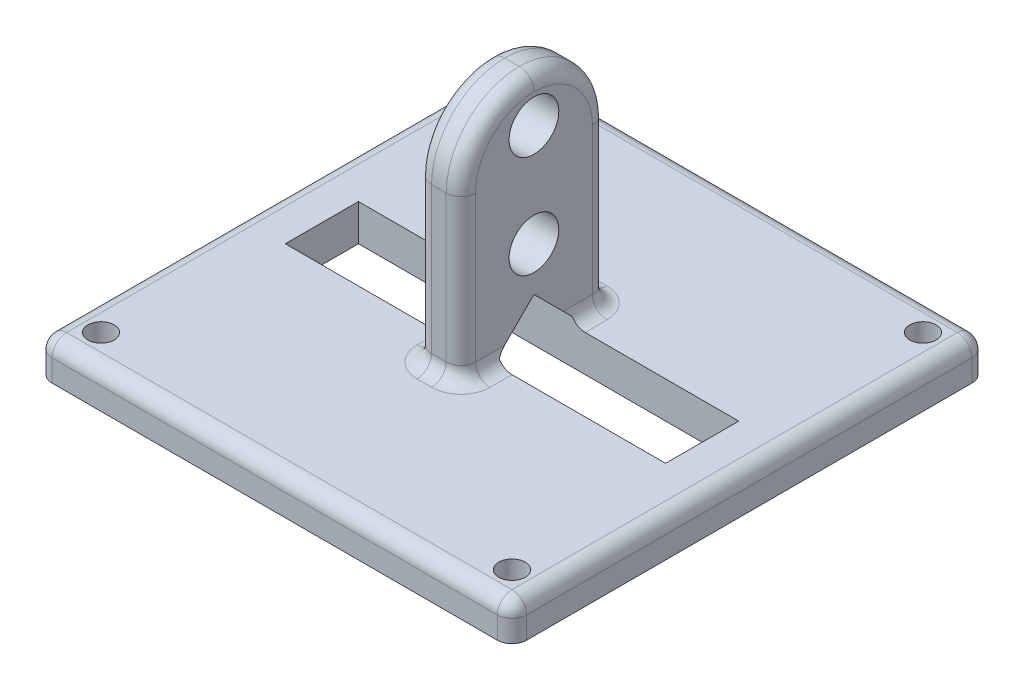
from build123d import *

# Parameters (mm, degrees)
SKETCH1_W            = 32.45
SKETCH1_H            = 32.45
SKETCH1_R            = 0.9
SKETCH1_W_2          = 26
SKETCH1_H_2          = 5
BOSS_EXTRUDE1_DEPTH  = 2.5
SKETCH3_W            = 3
SKETCH3_H            = 2.5
BOSS_EXTRUDE2_DEPTH  = 3
SKETCH4_W            = 3
SKETCH4_H            = 10
BOSS_EXTRUDE3_DEPTH  = 13
CHAMFER1_SIZE        = 2.5
M3_CLEARANCE_HOLE2_D = 3.4
FILLET1_R            = 5
FILLET2_R            = 1


# Some blends are built 0.0001 mm under size
with BuildPart() as part:
    # Sketch1 → Boss-Extrude1 (new body)
    with BuildSketch(Plane(origin=(0, 0, 0), x_dir=(1, 0, 0), z_dir=(0, 1, 0))):
        Rectangle(SKETCH1_W, SKETCH1_H)
        with Locations(Location((-14.05, 14.05, 0), (0, 0, 270))):
            Circle(SKETCH1_R, mode=Mode.SUBTRACT)
        with Locations(Location((14.05, 14.05, 0), (0, 0, 270))):
            Circle(SKETCH1_R, mode=Mode.SUBTRACT)
        with Locations(Location((14.05, -14.05, 0), (0, 0, 270))):
            Circle(SKETCH1_R, mode=Mode.SUBTRACT)
        with Locations(Location((-14.05, -14.05, 0), (0, 0, 270))):
            Circle(SKETCH1_R, mode=Mode.SUBTRACT)
        Rectangle(SKETCH1_W_2, SKETCH1_H_2, mode=Mode.SUBTRACT)
    extrude(amount=BOSS_EXTRUDE1_DEPTH)

    # Sketch3 → Boss-Extrude2 (add)
    with BuildSketch(Plane(origin=(0, 2.5, 0), x_dir=(1, 0, 0), z_dir=(0, 1, 0))):
        with Locations((0, -3.75)):
            Rectangle(SKETCH3_W, SKETCH3_H)
        with Locations((0, 3.75)):
            Rectangle(SKETCH3_W, SKETCH3_H)
    extrude(amount=BOSS_EXTRUDE2_DEPTH)

    # Sketch4 → Boss-Extrude3 (add)
    with BuildSketch(Plane(origin=(0, 5.5, 0), x_dir=(1, 0, 0), z_dir=(0, 1, 0))):
        Rectangle(SKETCH4_W, SKETCH4_H)
    extrude(amount=BOSS_EXTRUDE3_DEPTH)

    # Chamfer1
    chamfer1_edges = [part.edges().sort_by_distance(p)[0] for p in [
        (0, 5.5, 2.5),
        (0, 5.5, -2.5),
    ]]
    chamfer(chamfer1_edges, length=CHAMFER1_SIZE - 0.0001)  # a hair under: the kernel refuses the full size

    # M3 Clearance Hole2 (through all)
    with Locations(Plane(origin=(1.5, 0, 0), x_dir=(0, 0, -1), z_dir=(1, 0, 0))):
        with Locations((0, 15.5), (0, 8.5)):
            Hole(M3_CLEARANCE_HOLE2_D / 2)

    # Fillet1
    fillet1_edges = [part.edges().sort_by_distance(p)[0] for p in [
        (0, 18.5, -5),
        (0, 18.5, 5),
    ]]
    fillet(fillet1_edges, radius=FILLET1_R - 0.0001)  # a hair under: the kernel refuses the full size

    # Fillet2
    # the kernel refuses this fillet: 1 mm, written as the material it takes off along each edge
    with BuildSketch(Plane(origin=(-15.225, 1.5, -15.225), x_dir=(0, 0, -1), z_dir=(-1, 0, 0))) as fillet2_piece_1_section:
        Polygon((0, 0), (FILLET2_R, 0), (FILLET2_R, -FILLET2_R), (0, -FILLET2_R), align=None)
    fillet2_piece_1 = extrude(amount=FILLET2_R, mode=Mode.PRIVATE)
    fillet2_piece_1 = fillet2_piece_1 - Plane(origin=(-15.225, 1.5, -15.225), x_dir=(0, -0.7071067811865475, 0.7071067811865475), z_dir=(-1, 0, 0)) * Sphere(FILLET2_R, mode=Mode.PRIVATE)
    add(fillet2_piece_1, mode=Mode.SUBTRACT)
    with BuildSketch(Plane(origin=(15.225, 1.5, -15.225), x_dir=(0, 0, -1), z_dir=(1, 0, 0))) as fillet2_piece_2_section:
        Polygon((0, 0), (FILLET2_R, 0), (FILLET2_R, FILLET2_R), (0, FILLET2_R), align=None)
    fillet2_piece_2 = extrude(amount=FILLET2_R, mode=Mode.PRIVATE)
    fillet2_piece_2 = fillet2_piece_2 - Plane(origin=(15.225, 1.5, -15.225), x_dir=(0, -0.7071067811865475, 0.7071067811865475), z_dir=(1, 0, 0)) * Sphere(FILLET2_R, mode=Mode.PRIVATE)
    add(fillet2_piece_2, mode=Mode.SUBTRACT)
    with BuildSketch(Plane(origin=(-15.225, 1.5, 15.225), x_dir=(0, 1, 0), z_dir=(-1, 0, 0))) as fillet2_piece_3_section:
        Polygon((0, 0), (FILLET2_R, 0), (FILLET2_R, -FILLET2_R), (0, -FILLET2_R), align=None)
    fillet2_piece_3 = extrude(amount=FILLET2_R, mode=Mode.PRIVATE)
    fillet2_piece_3 = fillet2_piece_3 - Plane(origin=(-15.225, 1.5, 15.225), x_dir=(0, -0.7071067811865475, -0.7071067811865475), z_dir=(-1, 0, 0)) * Sphere(FILLET2_R, mode=Mode.PRIVATE)
    add(fillet2_piece_3, mode=Mode.SUBTRACT)
    with BuildSketch(Plane(origin=(15.225, 1.5, 15.225), x_dir=(0, 1, 0), z_dir=(1, 0, 0))) as fillet2_piece_4_section:
        Polygon((0, 0), (FILLET2_R, 0), (FILLET2_R, FILLET2_R), (0, FILLET2_R), align=None)
    fillet2_piece_4 = extrude(amount=FILLET2_R, mode=Mode.PRIVATE)
    fillet2_piece_4 = fillet2_piece_4 - Plane(origin=(15.225, 1.5, 15.225), x_dir=(0, -0.7071067811865475, -0.7071067811865475), z_dir=(1, 0, 0)) * Sphere(FILLET2_R, mode=Mode.PRIVATE)
    add(fillet2_piece_4, mode=Mode.SUBTRACT)
    with BuildSketch(Plane(origin=(-1.5, 13.5001, -5), x_dir=(0, 0, 1), z_dir=(0, -1, 0))) as fillet2_piece_5:
        with BuildLine():
            CenterArc((FILLET2_R, -FILLET2_R), FILLET2_R, 90, 90)
            Line((0, -FILLET2_R), (0, 0))
            Line((0, 0), (FILLET2_R, 0))
        make_face()
    extrude(amount=11.0001, mode=Mode.SUBTRACT)
    with BuildSketch(Plane(origin=(-1.5, 13.5001, -0.0001), x_dir=(0, 1, 0), z_dir=(0, 0, 1))) as fillet2_piece_6:
        with BuildLine():
            CenterArc((4.9999 - FILLET2_R, -FILLET2_R), FILLET2_R, 0, 90)
            Line((4.9999, -FILLET2_R), (4.9999, 0))
            Line((4.9999, 0), (4.9999 - FILLET2_R, 0))
        make_face()
    revolve(axis=Axis((-1.5, 13.5001, -0.0001), (-1, 0, 0)), revolution_arc=90, mode=Mode.SUBTRACT)
    with BuildSketch(Plane(origin=(-1.5, 13.5001, 0.0001), x_dir=(0, 0, 1), z_dir=(0, -1, 0))) as fillet2_piece_7:
        with BuildLine():
            CenterArc((4.9999 - FILLET2_R, -FILLET2_R), FILLET2_R, 0, 90)
            Line((4.9999, -FILLET2_R), (4.9999, 0))
            Line((4.9999, 0), (4.9999 - FILLET2_R, 0))
        make_face()
    revolve(axis=Axis((-1.5, 13.5001, 0.0001), (-1, 0, 0)), revolution_arc=90, mode=Mode.SUBTRACT)
    with BuildSketch(Plane(origin=(1.5, 2.5, -5), x_dir=(-1, 0, 0), z_dir=(0, 1, 0)), Plane(origin=(-1.5, 13.5001, 5), x_dir=(0, 0, -1), z_dir=(0, -1, 0)), Plane(origin=(1.5, 13.5001, 5), x_dir=(-1, 0, 0), z_dir=(0, -1, 0))) as fillet2_piece_8:
        with BuildLine():
            CenterArc((FILLET2_R, FILLET2_R), FILLET2_R, 180, 90)
            Line((0, FILLET2_R), (0, 0))
            Line((0, 0), (FILLET2_R, 0))
        make_face()
    extrude(amount=11.0001, mode=Mode.SUBTRACT)
    with BuildSketch(Plane(origin=(1.5, 13.5001, -0.0001), x_dir=(0, 1, 0), z_dir=(0, 0, 1))) as fillet2_piece_9:
        with BuildLine():
            CenterArc((4.9999 - FILLET2_R, FILLET2_R), FILLET2_R, 270, 90)
            Line((4.9999 - FILLET2_R, 0), (4.9999, 0))
            Line((4.9999, 0), (4.9999, FILLET2_R))
        make_face()
    revolve(axis=Axis((1.5, 13.5001, -0.0001), (-1, 0, 0)), revolution_arc=90, mode=Mode.SUBTRACT)
    with BuildSketch(Plane(origin=(1.5, 13.5001, 0.0001), x_dir=(0, 0, 1), z_dir=(0, -1, 0))) as fillet2_piece_10:
        with BuildLine():
            CenterArc((4.9999 - FILLET2_R, FILLET2_R), FILLET2_R, 270, 90)
            Line((4.9999 - FILLET2_R, 0), (4.9999, 0))
            Line((4.9999, 0), (4.9999, FILLET2_R))
        make_face()
    revolve(axis=Axis((1.5, 13.5001, 0.0001), (-1, 0, 0)), revolution_arc=90, mode=Mode.SUBTRACT)
    with BuildSketch(Plane(origin=(-15.225, 2.5, -16.225), x_dir=(0, 0, 1), z_dir=(1, 0, 0)), Plane(origin=(-16.225, 2.5, 15.225), x_dir=(1, 0, 0), z_dir=(0, 0, -1)), Plane(origin=(15.225, 2.5, 16.225), x_dir=(0, 0, -1), z_dir=(-1, 0, 0)), Plane(origin=(16.225, 2.5, -15.225), x_dir=(-1, 0, 0), z_dir=(0, 0, 1))) as fillet2_piece_11:
        with BuildLine():
            CenterArc((FILLET2_R, FILLET2_R), FILLET2_R, 180, 90)
            Line((0, FILLET2_R), (0, 0))
            Line((0, 0), (FILLET2_R, 0))
        make_face()
    extrude(amount=30.45, mode=Mode.SUBTRACT)
    with BuildSketch(Plane(origin=(-16.225, -2.5, 16.225), x_dir=(1, 0, 0), z_dir=(0, 1, 0)), Plane(origin=(-16.225, -2.5, -16.225), x_dir=(0, 0, 1), z_dir=(0, 1, 0))) as fillet2_piece_12:
        with BuildLine():
            CenterArc((FILLET2_R, FILLET2_R), FILLET2_R, 180, 90)
            Line((0, FILLET2_R), (0, 0))
            Line((0, 0), (FILLET2_R, 0))
        make_face()
    extrude(amount=4, mode=Mode.SUBTRACT)
    with BuildSketch(Plane(origin=(16.225, -2.5, -16.225), x_dir=(0, 0, 1), z_dir=(0, 1, 0)), Plane(origin=(16.225, -2.5, 16.225), x_dir=(-1, 0, 0), z_dir=(0, 1, 0))) as fillet2_piece_13:
        with BuildLine():
            CenterArc((FILLET2_R, -FILLET2_R), FILLET2_R, 90, 90)
            Line((0, -FILLET2_R), (0, 0))
            Line((0, 0), (FILLET2_R, 0))
        make_face()
    extrude(amount=4, mode=Mode.SUBTRACT)
    with BuildSketch(Plane(origin=(1.5, 18.5, -0.0001), x_dir=(-1, 0, 0), z_dir=(0, 0, 1))) as fillet2_piece_14:
        with BuildLine():
            CenterArc((FILLET2_R, FILLET2_R), FILLET2_R, 180, 90)
            Line((0, FILLET2_R), (0, 0))
            Line((0, 0), (FILLET2_R, 0))
        make_face()
    extrude(amount=0.0002, mode=Mode.SUBTRACT)
    with BuildSketch(Plane(origin=(-1.5, 18.5, 0.0001), x_dir=(0, -1, 0), z_dir=(0, 0, -1))) as fillet2_piece_15:
        with BuildLine():
            CenterArc((FILLET2_R, -FILLET2_R), FILLET2_R, 90, 90)
            Line((0, -FILLET2_R), (0, 0))
            Line((0, 0), (FILLET2_R, 0))
        make_face()
    extrude(amount=0.0002, mode=Mode.SUBTRACT)
    # the kernel refuses this fillet: 1 mm, written as the material it adds along each edge
    with BuildSketch(Plane(origin=(-1.5, 2.5, -4), x_dir=(0, 1, 0), z_dir=(0, 0, 1))) as fillet2_2_piece_1_section:
        with BuildLine():
            CenterArc((FILLET2_R, FILLET2_R), FILLET2_R, 180, 90)
            Line((0, FILLET2_R), (0, 0))
            Line((0, 0), (FILLET2_R, 0))
        make_face()
    fillet2_2_piece_1 = extrude(amount=1.5, mode=Mode.PRIVATE)
    fillet2_2_piece_1 = split(fillet2_2_piece_1, bisect_by=Plane(origin=(-1.7072894, 2.435643561, -3.064456439), z_dir=(0, 0.7071067811865476, -0.7071067811865476)), keep=Keep.TOP, mode=Mode.PRIVATE)
    add(fillet2_2_piece_1)
    with BuildSketch(Plane(origin=(-1.5, 2.5, -4), x_dir=(0, 1, 0), z_dir=(0, 0, 1))) as fillet2_2_piece_2_section:
        with BuildLine():
            CenterArc((FILLET2_R, FILLET2_R), FILLET2_R, 180, 90)
            Line((0, FILLET2_R), (0, 0))
            Line((0, 0), (FILLET2_R, 0))
        make_face()
    fillet2_2_piece_2 = extrude(amount=1.5, mode=Mode.PRIVATE)
    fillet2_2_piece_2 = split(fillet2_2_piece_2, bisect_by=Plane(origin=(-1.804773182, 2.70404687, -2.79605313), z_dir=(0, -0.7071067811865476, 0.7071067811865476)), keep=Keep.TOP, mode=Mode.PRIVATE)
    add(fillet2_2_piece_2)
    with BuildSketch(Plane(origin=(-1.5, 2.5, -4), x_dir=(0, 1, 0), z_dir=(0, 0, 1))) as fillet2_2_piece_3_section:
        with BuildLine():
            CenterArc((FILLET2_R, FILLET2_R), FILLET2_R, 180, 90)
            Line((0, FILLET2_R), (0, 0))
            Line((0, 0), (FILLET2_R, 0))
        make_face()
    fillet2_2_piece_3 = extrude(amount=4, mode=Mode.PRIVATE)
    fillet2_2_piece_3 = split(fillet2_2_piece_3, bisect_by=Plane(origin=(-1.50867739, 3.263680502, -2.5), z_dir=(0, 0, 1)), keep=Keep.TOP, mode=Mode.PRIVATE)
    fillet2_2_piece_3 = split(fillet2_2_piece_3, bisect_by=Plane(origin=(-1.50867739, 3.197785377, -2.302314623), z_dir=(0, 0.7071067811865476, -0.7071067811865476)), keep=Keep.TOP, mode=Mode.PRIVATE)
    add(fillet2_2_piece_3)
    with BuildSketch(Plane(origin=(1.5, 2.5, 0), x_dir=(1, 0, 0), z_dir=(0, 0, -1))) as fillet2_2_piece_4_section:
        with BuildLine():
            CenterArc((FILLET2_R, -FILLET2_R), FILLET2_R, 90, 90)
            Line((0, -FILLET2_R), (0, 0))
            Line((0, 0), (FILLET2_R, 0))
        make_face()
    fillet2_2_piece_4 = extrude(amount=4, mode=Mode.PRIVATE)
    fillet2_2_piece_4 = split(fillet2_2_piece_4, bisect_by=Plane(origin=(1.508677391, 3.2636805, -2.5), z_dir=(0, 0, 1)), keep=Keep.TOP, mode=Mode.PRIVATE)
    fillet2_2_piece_4 = split(fillet2_2_piece_4, bisect_by=Plane(origin=(1.508677391, 3.197785375, -2.302314625), z_dir=(0, 0.7071067811865476, -0.7071067811865476)), keep=Keep.TOP, mode=Mode.PRIVATE)
    add(fillet2_2_piece_4)
    with BuildSketch(Plane(origin=(1.5, 2.5, -2.5), x_dir=(1, 0, 0), z_dir=(0, 0, -1))) as fillet2_2_piece_5_section:
        with BuildLine():
            CenterArc((FILLET2_R, -FILLET2_R), FILLET2_R, 90, 90)
            Line((0, -FILLET2_R), (0, 0))
            Line((0, 0), (FILLET2_R, 0))
        make_face()
    fillet2_2_piece_5 = extrude(amount=1.5, mode=Mode.PRIVATE)
    fillet2_2_piece_5 = split(fillet2_2_piece_5, bisect_by=Plane(origin=(1.804773183, 2.704046871, -2.796053129), z_dir=(0, -0.7071067811865476, 0.7071067811865476)), keep=Keep.TOP, mode=Mode.PRIVATE)
    add(fillet2_2_piece_5)
    with BuildSketch(Plane(origin=(1.5, 2.5, -2.5), x_dir=(1, 0, 0), z_dir=(0, 0, -1))) as fillet2_2_piece_6_section:
        with BuildLine():
            CenterArc((FILLET2_R, -FILLET2_R), FILLET2_R, 90, 90)
            Line((0, -FILLET2_R), (0, 0))
            Line((0, 0), (FILLET2_R, 0))
        make_face()
    fillet2_2_piece_6 = extrude(amount=1.5, mode=Mode.PRIVATE)
    fillet2_2_piece_6 = split(fillet2_2_piece_6, bisect_by=Plane(origin=(1.707289398, 2.435643555, -3.064456445), z_dir=(0, 0.7071067811865476, -0.7071067811865476)), keep=Keep.TOP, mode=Mode.PRIVATE)
    add(fillet2_2_piece_6)
    with BuildSketch(Plane(origin=(0.5, 2.5, -5), x_dir=(0, 0, -1), z_dir=(-1, 0, 0)), Plane(origin=(-0.5, 2.5, 5), x_dir=(0, 0, 1), z_dir=(1, 0, 0))) as fillet2_2_piece_7:
        with BuildLine():
            CenterArc((FILLET2_R, -FILLET2_R), FILLET2_R, 90, 90)
            Line((0, -FILLET2_R), (0, 0))
            Line((0, 0), (FILLET2_R, 0))
        make_face()
    extrude(amount=1)
    with BuildSketch(Plane(origin=(-1.5, 2.5, 2.5), x_dir=(0, 1, 0), z_dir=(0, 0, 1))) as fillet2_2_piece_8_section:
        with BuildLine():
            CenterArc((FILLET2_R, FILLET2_R), FILLET2_R, 180, 90)
            Line((0, FILLET2_R), (0, 0))
            Line((0, 0), (FILLET2_R, 0))
        make_face()
    fillet2_2_piece_8 = extrude(amount=1.5, mode=Mode.PRIVATE)
    fillet2_2_piece_8 = split(fillet2_2_piece_8, bisect_by=Plane(origin=(-1.804773182, 2.70404687, 2.79605313), z_dir=(0, -0.7071067811865476, -0.7071067811865476)), keep=Keep.TOP, mode=Mode.PRIVATE)
    add(fillet2_2_piece_8)
    with BuildSketch(Plane(origin=(-1.5, 2.5, 0), x_dir=(0, 1, 0), z_dir=(0, 0, 1))) as fillet2_2_piece_9_section:
        with BuildLine():
            CenterArc((FILLET2_R, FILLET2_R), FILLET2_R, 180, 90)
            Line((0, FILLET2_R), (0, 0))
            Line((0, 0), (FILLET2_R, 0))
        make_face()
    fillet2_2_piece_9 = extrude(amount=4, mode=Mode.PRIVATE)
    fillet2_2_piece_9 = split(fillet2_2_piece_9, bisect_by=Plane(origin=(-1.50867739, 3.197785377, 2.302314623), z_dir=(0, 0.7071067811865476, 0.7071067811865476)), keep=Keep.TOP, mode=Mode.PRIVATE)
    fillet2_2_piece_9 = split(fillet2_2_piece_9, bisect_by=Plane(origin=(-1.50867739, 3.263680502, 2.5), z_dir=(0, 0, -1)), keep=Keep.TOP, mode=Mode.PRIVATE)
    add(fillet2_2_piece_9)
    with BuildSketch(Plane(origin=(-1.5, 2.5, 2.5), x_dir=(0, 1, 0), z_dir=(0, 0, 1))) as fillet2_2_piece_10_section:
        with BuildLine():
            CenterArc((FILLET2_R, FILLET2_R), FILLET2_R, 180, 90)
            Line((0, FILLET2_R), (0, 0))
            Line((0, 0), (FILLET2_R, 0))
        make_face()
    fillet2_2_piece_10 = extrude(amount=1.5, mode=Mode.PRIVATE)
    fillet2_2_piece_10 = split(fillet2_2_piece_10, bisect_by=Plane(origin=(-1.7072894, 2.435643561, 3.064456439), z_dir=(0, 0.7071067811865476, 0.7071067811865476)), keep=Keep.TOP, mode=Mode.PRIVATE)
    add(fillet2_2_piece_10)
    with BuildSketch(Plane(origin=(1.5, 2.5, 4), x_dir=(1, 0, 0), z_dir=(0, 0, -1))) as fillet2_2_piece_11_section:
        with BuildLine():
            CenterArc((FILLET2_R, -FILLET2_R), FILLET2_R, 90, 90)
            Line((0, -FILLET2_R), (0, 0))
            Line((0, 0), (FILLET2_R, 0))
        make_face()
    fillet2_2_piece_11 = extrude(amount=1.5, mode=Mode.PRIVATE)
    fillet2_2_piece_11 = split(fillet2_2_piece_11, bisect_by=Plane(origin=(1.707289398, 2.435643555, 3.064456445), z_dir=(0, 0.7071067811865476, 0.7071067811865476)), keep=Keep.TOP, mode=Mode.PRIVATE)
    add(fillet2_2_piece_11)
    with BuildSketch(Plane(origin=(1.5, 2.5, 4), x_dir=(1, 0, 0), z_dir=(0, 0, -1))) as fillet2_2_piece_12_section:
        with BuildLine():
            CenterArc((FILLET2_R, -FILLET2_R), FILLET2_R, 90, 90)
            Line((0, -FILLET2_R), (0, 0))
            Line((0, 0), (FILLET2_R, 0))
        make_face()
    fillet2_2_piece_12 = extrude(amount=4, mode=Mode.PRIVATE)
    fillet2_2_piece_12 = split(fillet2_2_piece_12, bisect_by=Plane(origin=(1.508677391, 3.2636805, 2.5), z_dir=(0, 0, -1)), keep=Keep.TOP, mode=Mode.PRIVATE)
    fillet2_2_piece_12 = split(fillet2_2_piece_12, bisect_by=Plane(origin=(1.508677391, 3.197785375, 2.302314625), z_dir=(0, 0.7071067811865476, 0.7071067811865476)), keep=Keep.TOP, mode=Mode.PRIVATE)
    add(fillet2_2_piece_12)
    with BuildSketch(Plane(origin=(1.5, 2.5, 4), x_dir=(1, 0, 0), z_dir=(0, 0, -1))) as fillet2_2_piece_13_section:
        with BuildLine():
            CenterArc((FILLET2_R, -FILLET2_R), FILLET2_R, 90, 90)
            Line((0, -FILLET2_R), (0, 0))
            Line((0, 0), (FILLET2_R, 0))
        make_face()
    fillet2_2_piece_13 = extrude(amount=1.5, mode=Mode.PRIVATE)
    fillet2_2_piece_13 = split(fillet2_2_piece_13, bisect_by=Plane(origin=(1.804773183, 2.704046871, 2.796053129), z_dir=(0, -0.7071067811865476, -0.7071067811865476)), keep=Keep.TOP, mode=Mode.PRIVATE)
    add(fillet2_2_piece_13)
    with BuildSketch(Plane(origin=(0.5, 2.5, 4), x_dir=(0, 0, 1), z_dir=(-1, 0, 0))) as fillet2_2_piece_14:
        with BuildLine():
            CenterArc((1 + FILLET2_R, FILLET2_R), FILLET2_R, 180, 90)
            Line((1, FILLET2_R), (1, 0))
            Line((1, 0), (1 + FILLET2_R, 0))
        make_face()
    revolve(axis=Axis((0.5, 2.5, 4), (0, 1, 0)), revolution_arc=90)
    with BuildSketch(Plane(origin=(-0.5, 2.5, 4), x_dir=(-1, 0, 0), z_dir=(0, 0, -1))) as fillet2_2_piece_15:
        with BuildLine():
            CenterArc((1 + FILLET2_R, FILLET2_R), FILLET2_R, 180, 90)
            Line((1, FILLET2_R), (1, 0))
            Line((1, 0), (1 + FILLET2_R, 0))
        make_face()
    revolve(axis=Axis((-0.5, 2.5, 4), (0, 1, 0)), revolution_arc=90)
    with BuildSketch(Plane(origin=(0.5, 2.5, -4), x_dir=(0, 0, -1), z_dir=(-1, 0, 0))) as fillet2_2_piece_16:
        with BuildLine():
            CenterArc((1 + FILLET2_R, -FILLET2_R), FILLET2_R, 90, 90)
            Line((1, -FILLET2_R), (1, 0))
            Line((1, 0), (1 + FILLET2_R, 0))
        make_face()
    revolve(axis=Axis((0.5, 2.5, -4), (0, -1, 0)), revolution_arc=90)
    with BuildSketch(Plane(origin=(-0.5, 2.5, -4), x_dir=(-1, 0, 0), z_dir=(0, 0, 1))) as fillet2_2_piece_17:
        with BuildLine():
            CenterArc((1 + FILLET2_R, -FILLET2_R), FILLET2_R, 90, 90)
            Line((1 + FILLET2_R, 0), (1, 0))
            Line((1, 0), (1, -FILLET2_R))
        make_face()
    revolve(axis=Axis((-0.5, 2.5, -4), (0, -1, 0)), revolution_arc=90)


solid = part.part
